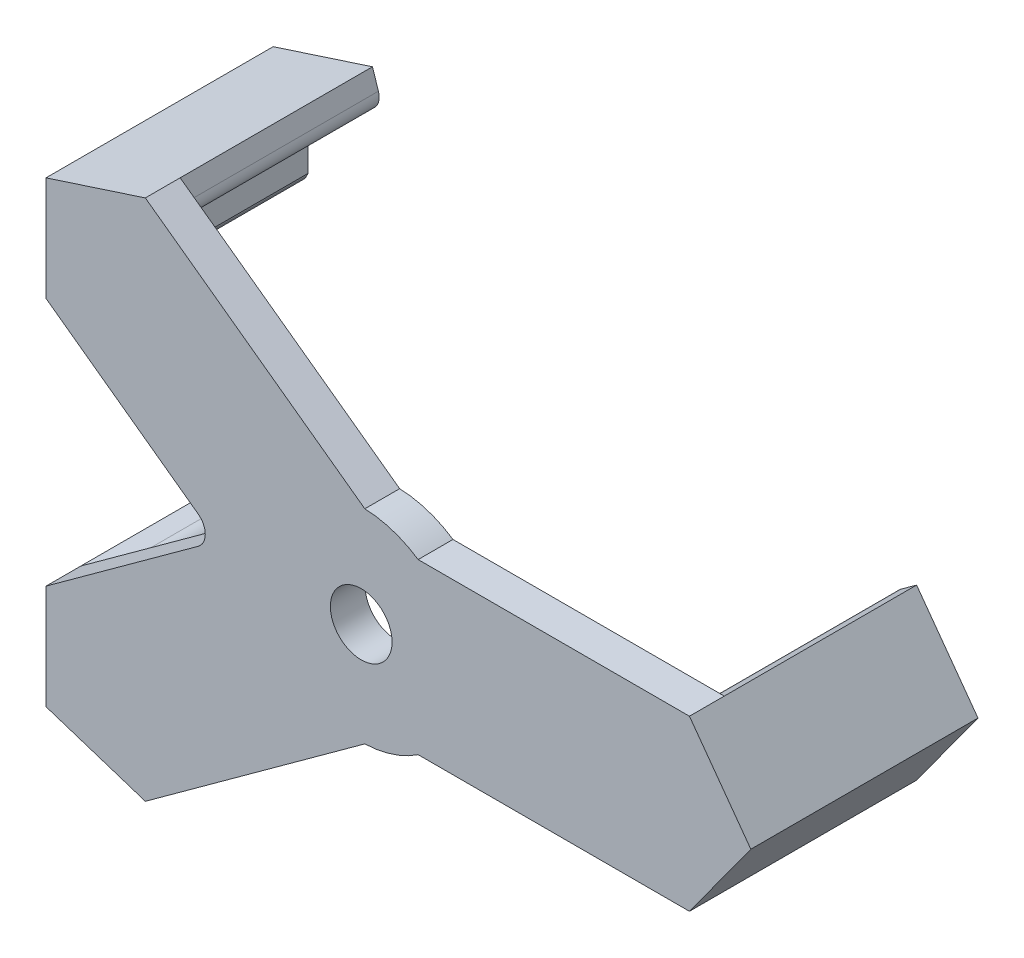
from build123d import *

# Parameters (mm, degrees)
BOSS_EXTRUDE1_DEPTH  = 14.025885253
BOSS_EXTRUDE2_DEPTH  = 2.54
CIRPATTERN1_START    = 14.025885253
CIRPATTERN1_DEPTH    = 2.54
CIRPATTERN1_2_DEPTH  = 14.025885253
FILLET1_R            = 1.27
M4_CLEARANCE_HOLE1_D = 4.5


# Read off the part's stored shape, not the designer's step: CirPattern1
with BuildPart() as part:
    # Sketch1 → Boss-Extrude1 (new body)
    with BuildSketch(Plane.XY):
        with BuildLine():
            Line((-22.987, 16.701033091), (-22.987, 9.084847245))
            Line((-22.987, 9.084847245), (-21.59, 9.084847245))
            ThreePointArc((-21.59, 9.084847245), (-20.982965782, 9.25936469), (-20.5613, 9.729625096))
            Line((-20.5613, 9.729625096), (-20.447, 9.965625061))
            Line((-20.447, 9.965625061), (-20.447, 14.85561507))
            Line((-20.447, 14.85561507), (-15.796343137, 16.366705085))
            Line((-15.796343137, 16.366705085), (-15.607214475, 16.548338845))
            ThreePointArc((-15.607214475, 16.548338845), (-15.290272145, 17.094685292), (-15.31188008, 17.725937997))
            Line((-15.31188008, 17.725937997), (-15.743576822, 19.05456395))
            Line((-15.743576822, 19.05456395), (-22.987, 16.701033091))
        make_face()
    extrude(amount=BOSS_EXTRUDE1_DEPTH)

    # Sketch2 → Boss-Extrude2 (add)
    with BuildSketch(Plane.XY.offset(14.025885253)):
        with BuildLine():
            Line((-22.987, 9.084847245), (-6.980044584, -2.544886608))
            ThreePointArc((-6.980044584, -2.544886608), (6.01059176, -4.366950532), (0.263378594, 7.424830097))
            Line((0.263378594, 7.424830097), (-15.743576822, 19.05456395))
            Line((-15.743576822, 19.05456395), (-22.987, 16.701033091))
            Line((-22.987, 16.701033091), (-22.987, 9.084847245))
        make_face()
    extrude(amount=BOSS_EXTRUDE2_DEPTH)

    # CirPattern1 outline → CirPattern1 (add)
    with BuildSketch(Plane.XY.offset(CIRPATTERN1_START)):
        with BuildLine():
            Line((-10.482780502, 0), (-22.987, -9.084847245))
            Line((-22.987, -9.084847245), (-22.987, -16.701033091))
            Line((-22.987, -16.701033091), (-15.743576822, -19.05456395))
            Line((-15.743576822, -19.05456395), (0.263378594, -7.424830097))
            ThreePointArc((0.263378594, -7.424830097), (-4.151127873, -6.161623782), (-6.980044584, -2.544886608))
            Line((-6.980044584, -2.544886608), (-10.482780502, 0))
        make_face()
        with BuildLine():
            ThreePointArc((4.151127873, 6.161623782), (7.4295, 0), (4.151127873, -6.161623782))
            Line((4.151127873, -6.161623782), (23.93681288, -6.161623782))
            Line((23.93681288, -6.161623782), (28.413494599, 0))
            Line((28.413494599, 0), (23.93681288, 6.161623782))
            Line((23.93681288, 6.161623782), (4.151127873, 6.161623782))
        make_face()
    extrude(amount=CIRPATTERN1_DEPTH)

    # CirPattern1 2 outline → CirPattern1 2 (add)
    with BuildSketch(Plane.XY):
        with BuildLine():
            Line((-20.447, -14.85561507), (-20.447, -9.965625061))
            Line((-20.447, -9.965625061), (-20.5613, -9.729625096))
            ThreePointArc((-20.5613, -9.729625096), (-20.982965782, -9.25936469), (-21.59, -9.084847245))
            Line((-21.59, -9.084847245), (-22.987, -9.084847245))
            Line((-22.987, -9.084847245), (-22.987, -16.701033091))
            Line((-22.987, -16.701033091), (-15.743576822, -19.05456395))
            Line((-15.743576822, -19.05456395), (-15.31188008, -17.725937997))
            ThreePointArc((-15.31188008, -17.725937997), (-15.290272145, -17.094685292), (-15.607214475, -16.548338845))
            Line((-15.607214475, -16.548338845), (-15.796343137, -16.366705085))
            Line((-15.796343137, -16.366705085), (-20.447, -14.85561507))
        make_face()
        with BuildLine():
            Line((22.806616138, -5.340487785), (23.93681288, -6.161623782))
            Line((23.93681288, -6.161623782), (28.413494599, 0))
            Line((28.413494599, 0), (23.93681288, 6.161623782))
            Line((23.93681288, 6.161623782), (22.806616138, 5.340487785))
            ThreePointArc((22.806616138, 5.340487785), (22.418093921, 4.842494444), (22.353371268, 4.214196857))
            Line((22.353371268, 4.214196857), (22.399617925, 3.95608502))
            Line((22.399617925, 3.95608502), (25.273881936, 0))
            Line((25.273881936, 0), (22.399617925, -3.95608502))
            Line((22.399617925, -3.95608502), (22.353371268, -4.214196857))
            ThreePointArc((22.353371268, -4.214196857), (22.418093921, -4.842494444), (22.806616138, -5.340487785))
        make_face()
    extrude(amount=CIRPATTERN1_2_DEPTH)

    # Fillet1
    fillet1_edges = [part.edges().sort_by_distance(p)[0] for p in [
        (-10.482780502, 0, 15.295885253),
    ]]
    fillet(fillet1_edges, radius=FILLET1_R)

    # M4 Clearance Hole1 (through all)
    with Locations(Plane.XY.offset(16.565885253)):
        with Locations((0, 0)):
            Hole(M4_CLEARANCE_HOLE1_D / 2)


solid = part.part
